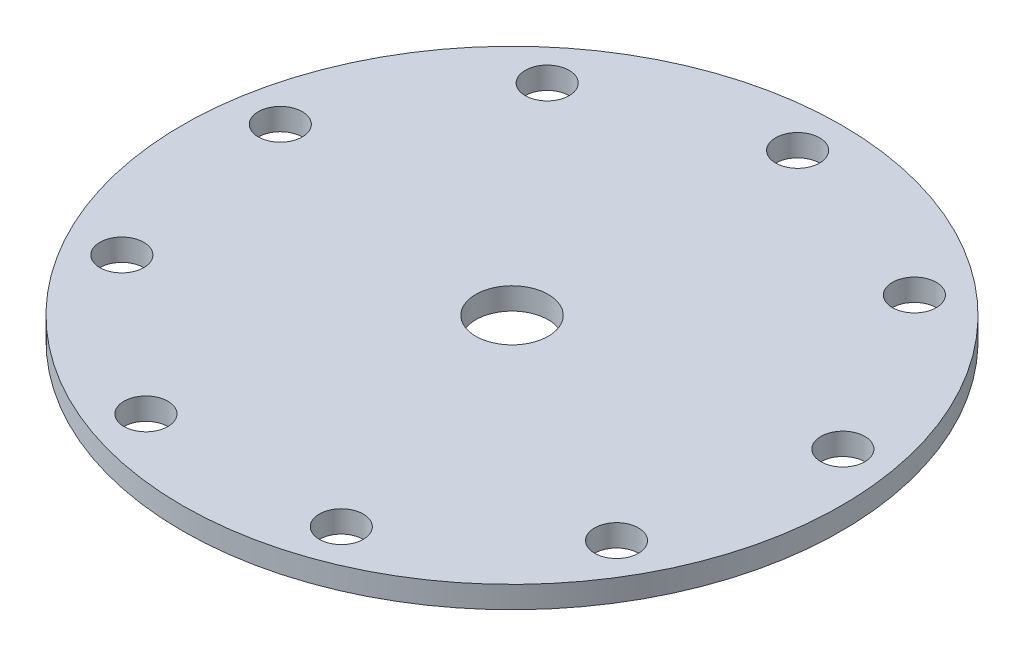
from build123d import *

# Parameters (mm, degrees)
SKETCH_1_R      = 60
SKETCH_1_R_2    = 4
SKETCH_1_R_3    = 6.6
EXTRUDE_1_DEPTH = 4


with BuildPart() as part:
    # 草图1 → 凸台-拉伸1 (new body)
    with BuildSketch(Plane(origin=(0, 0, 0), x_dir=(1, 0, 0), z_dir=(0, 1, 0))):
        Circle(SKETCH_1_R)
        with Locations((0, 52)):
            Circle(SKETCH_1_R_2, mode=Mode.SUBTRACT)
        with Locations((33.424955704, 39.834311042)):
            Circle(SKETCH_1_R_2, mode=Mode.SUBTRACT)
        with Locations((51.210003157, 9.029705239)):
            Circle(SKETCH_1_R_2, mode=Mode.SUBTRACT)
        with Locations((45.033320997, -26)):
            Circle(SKETCH_1_R_2, mode=Mode.SUBTRACT)
        with Locations((17.785047453, -48.864016281)):
            Circle(SKETCH_1_R_2, mode=Mode.SUBTRACT)
        with Locations((-17.785047453, -48.864016281)):
            Circle(SKETCH_1_R_2, mode=Mode.SUBTRACT)
        with Locations((-45.033320997, -26)):
            Circle(SKETCH_1_R_2, mode=Mode.SUBTRACT)
        with Locations((-51.210003157, 9.029705239)):
            Circle(SKETCH_1_R_2, mode=Mode.SUBTRACT)
        with Locations((-33.424955704, 39.834311042)):
            Circle(SKETCH_1_R_2, mode=Mode.SUBTRACT)
        Circle(SKETCH_1_R_3, mode=Mode.SUBTRACT)
    extrude(amount=EXTRUDE_1_DEPTH)


solid = part.part
